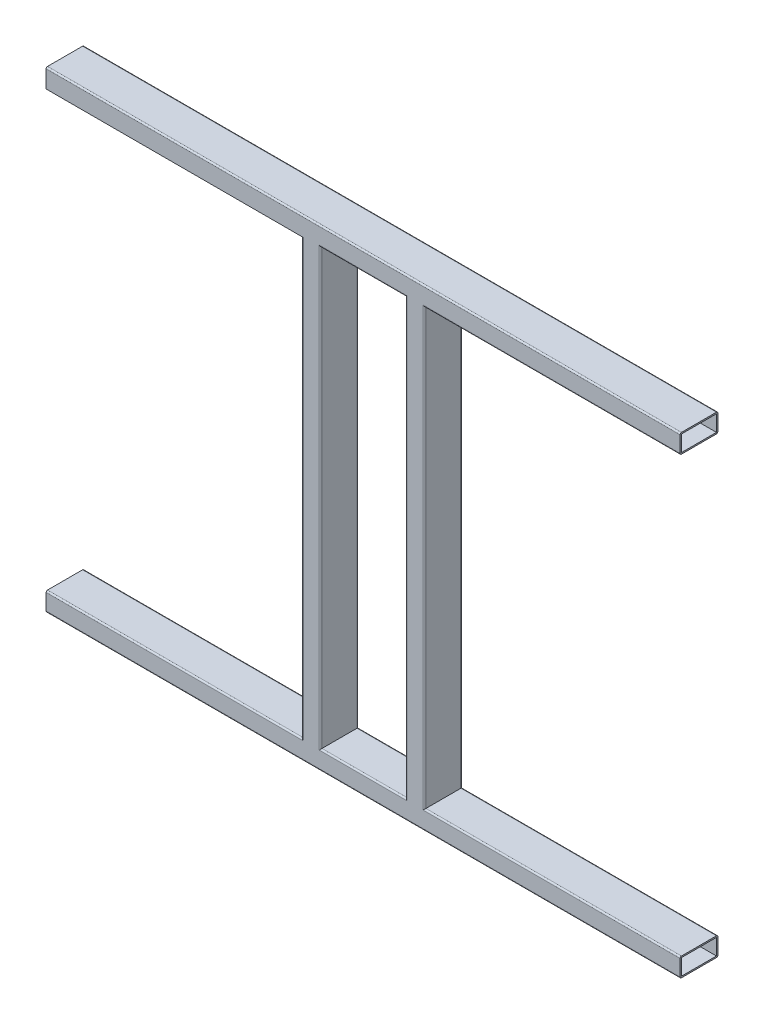
from build123d import *

# Parameters (mm, degrees)
SKETCH1_W               = 180
SKETCH1_H               = 920
BOSS_EXTRUDE1_DEPTH     = 80
FILLET2_R               = 3
SHELL1_START            = -497
SHELL1_OUTLINE_W        = 34
SHELL1_OUTLINE_H        = 74
SHELL1_DEPTH            = 994
SHELL1_2_OUTLINE_W      = 541
SHELL1_2_OUTLINE_H      = 74
SHELL1_2_OUTLINE_W_2    = 186
SHELL1_2_DEPTH          = 34
SHELL1_START_2          = 463
SHELL1_3_OUTLINE_W      = 541
SHELL1_3_OUTLINE_H      = 74
SHELL1_3_OUTLINE_W_2    = 186
SHELL1_3_DEPTH          = 34
CUT_EXTRUDE1_DEPTH      = 1435.351421375
CUT_EXTRUDE1_DEPTH_BACK = 1435.351421375
SKETCH2_W               = 74
SKETCH2_H               = 34


# Read off the part's stored shape, not the designer's step: Shell1
with BuildPart() as part:
    # Sketch1 → Boss-Extrude1 (new body)
    with BuildSketch(Plane.XY):
        Polygon((671, -500), (-671, -500), (-671, -460), (-130, -460), (-130, 460), (-671, 460), (-671, 500), (671, 500), (671, 460), (130, 460), (130, -460), (671, -460), align=None)
        Rectangle(SKETCH1_W, SKETCH1_H, mode=Mode.SUBTRACT)
    extrude(amount=-BOSS_EXTRUDE1_DEPTH)

    # Fillet2
    fillet2_edges = [part.edges().sort_by_distance(p)[0] for p in [
        (-90, 0, 0),
        (0, 460, 0),
        (400.5, 460, 0),
        (0, 500, 0),
        (0, -500, 0),
        (-400.5, -460, 0),
        (-130, 0, 0),
        (400.5, -460, 0),
        (0, -460, 0),
        (90, 0, 0),
        (130, 0, 0),
        (400.5, -460, -80),
        (0, -500, -80),
        (-400.5, -460, -80),
        (0, -460, -80),
        (130, 0, -80),
        (90, 0, -80),
        (-90, 0, -80),
        (-130, 0, -80),
        (-400.5, 460, -80),
        (0, 460, -80),
        (400.5, 460, -80),
        (0, 500, -80),
    ]]
    fillet(fillet2_edges, radius=FILLET2_R)

    # Shell1 outline → Shell1 (cut)
    with BuildSketch(Plane(origin=(0, 0, 0), x_dir=(1, 0, 0), z_dir=(0, 1, 0)).offset(SHELL1_START)):
        with Locations((-110, 40)):
            Rectangle(SHELL1_OUTLINE_W, SHELL1_OUTLINE_H)
        with Locations((110, 40)):
            Rectangle(SHELL1_OUTLINE_W, SHELL1_OUTLINE_H)
    extrude(amount=SHELL1_DEPTH, mode=Mode.SUBTRACT)

    # Shell1 2 outline → Shell1 2 (cut)
    with BuildSketch(Plane(origin=(0, 0, 0), x_dir=(1, 0, 0), z_dir=(0, 1, 0)).offset(SHELL1_START)):
        with Locations((-397.5, 40)):
            Rectangle(SHELL1_2_OUTLINE_W, SHELL1_2_OUTLINE_H)
        with Locations((0, 40)):
            Rectangle(SHELL1_2_OUTLINE_W_2, SHELL1_2_OUTLINE_H)
        with Locations((397.5, 40)):
            Rectangle(SHELL1_2_OUTLINE_W, SHELL1_2_OUTLINE_H)
    extrude(amount=SHELL1_2_DEPTH, mode=Mode.SUBTRACT)

    # Shell1 3 outline → Shell1 3 (cut)
    with BuildSketch(Plane(origin=(0, 0, 0), x_dir=(1, 0, 0), z_dir=(0, 1, 0)).offset(SHELL1_START_2)):
        with Locations((-397.5, 40)):
            Rectangle(SHELL1_3_OUTLINE_W, SHELL1_3_OUTLINE_H)
        with Locations((0, 40)):
            Rectangle(SHELL1_3_OUTLINE_W_2, SHELL1_3_OUTLINE_H)
        with Locations((397.5, 40)):
            Rectangle(SHELL1_3_OUTLINE_W, SHELL1_3_OUTLINE_H)
    extrude(amount=SHELL1_3_DEPTH, mode=Mode.SUBTRACT)

    # Sketch2 → Cut-Extrude1 (cut, two sides: drawn at the far end of the back side and taken through both)
    with BuildSketch(Plane(origin=(671, 0, 0), x_dir=(0, 0, -1), z_dir=(1, 0, 0)).offset(-CUT_EXTRUDE1_DEPTH_BACK)):
        with Locations((40, 480)):
            Rectangle(SKETCH2_W, SKETCH2_H)
        with Locations((40, -480)):
            Rectangle(SKETCH2_W, SKETCH2_H)
    extrude(amount=CUT_EXTRUDE1_DEPTH + CUT_EXTRUDE1_DEPTH_BACK, mode=Mode.SUBTRACT)


solid = part.part
